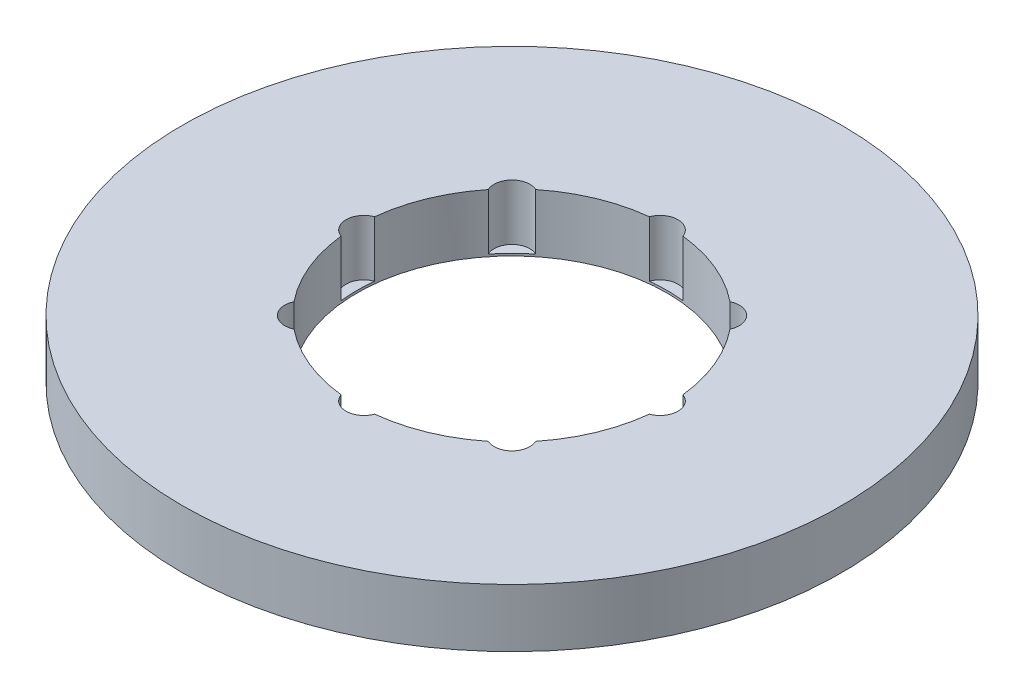
from build123d import *

# Parameters (mm, degrees)
SKETCH1_R           = 85
BOSS_EXTRUDE1_DEPTH = 15
SKETCH2_R           = 40
CUT_EXTRUDE1_DEPTH  = 122.140414396
SKETCH3_R           = 4.608597006
CUT_EXTRUDE2_DEPTH  = 14.406552789
CIRPATTERN1_COUNT   = 8


with BuildPart() as part:
    # Sketch1 → Boss-Extrude1 (new body)
    with BuildSketch(Plane(origin=(0, 0, 0), x_dir=(1, 0, 0), z_dir=(0, 1, 0))):
        Circle(SKETCH1_R)
    extrude(amount=BOSS_EXTRUDE1_DEPTH)

    # Sketch2 → Cut-Extrude1 (cut, through all)
    with BuildSketch(Plane(origin=(0, 0, 0), x_dir=(1, 0, 0), z_dir=(0, 1, 0))):
        Circle(SKETCH2_R)
    extrude(amount=CUT_EXTRUDE1_DEPTH, mode=Mode.SUBTRACT)

    # Sketch3 → Cut-Extrude2 (cut)
    with BuildSketch(Plane(origin=(0, 15, 0), x_dir=(1, 0, 0), z_dir=(0, 1, 0))):
        with Locations((-38.186141272, 0)):
            Circle(SKETCH3_R)
    cut_extrude2 = extrude(amount=-CUT_EXTRUDE2_DEPTH, mode=Mode.SUBTRACT)

    # CirPattern1: Cut-Extrude2 ×8 about axis
    cirpattern1_axis = Axis((0, 0, 0), (0, 1, 0))
    for i in range(1, CIRPATTERN1_COUNT):
        add(cut_extrude2.rotate(cirpattern1_axis, i * 360 / CIRPATTERN1_COUNT), mode=Mode.SUBTRACT)


solid = part.part
